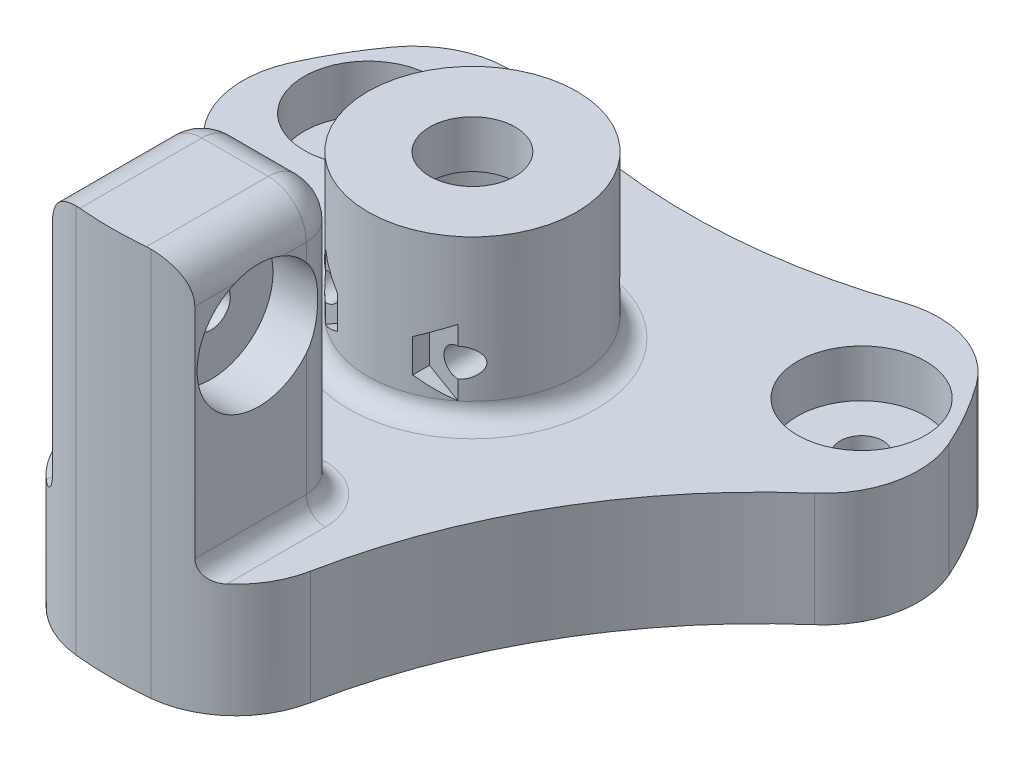
from build123d import *
from build123d.topology import SkipClean

# Parameters (mm, degrees)
SKETCH1_R                = 38
SKETCH1_R_2              = 2.25
SKETCH1_R_3              = 8
ESPESOR_BASE_MOVIL_DEPTH = 6
CUT_EXTRUDE12_START      = -6
SKETCH1_14_R             = 6.75
CUT_EXTRUDE12_DEPTH      = 5
CUT_EXTRUDE14_START      = 1
SKETCH1_16_R             = 6.75
CUT_EXTRUDE14_DEPTH      = 5
BOSS_EXTRUDE2_START      = 6
SKETCH1_8_R              = 11
SKETCH1_8_R_2            = 8
BOSS_EXTRUDE2_DEPTH      = 12
BOSS_EXTRUDE3_START      = 18
SKETCH1_9_R              = 11
BOSS_EXTRUDE3_DEPTH      = 5
CUT_EXTRUDE1_START       = 23
SKETCH1_10_R             = 4.5
CUT_EXTRUDE1_DEPTH       = 82.455110983
CUT_EXTRUDE4_START       = -8.5
SKETCH2_3_R              = 4
SKETCH2_3_R_2            = 1.5
CUT_EXTRUDE4_DEPTH       = 50.955110983
CUT_EXTRUDE5_START       = 8.5
CUT_EXTRUDE5_DEPTH       = 7
SKETCH3_R                = 2
BOSS_EXTRUDE4_DEPTH      = 7.5
CUT_EXTRUDE15_START      = -7.5
SKETCH3_4_R              = 6.5
CUT_EXTRUDE15_DEPTH      = 5
CUT_EXTRUDE16_START      = 2.5
SKETCH3_5_R              = 6.5
CUT_EXTRUDE16_DEPTH      = 5
CUT_EXTRUDE17_DEPTH      = 69.161572752
FILLET3_R                = 4
SKETCH5_R                = 11.25
CUT_EXTRUDE18_DEPTH      = 4
FILLET5_R                = 1
CUT_EXTRUDE19_DEPTH      = 10
CUT_EXTRUDE19_DEPTH_BACK = 10
SKETCH2_6_R              = 1.5
FILLET6_R                = 2
SKETCH6_R                = 49.897156105
CUT_EXTRUDE20_DEPTH      = 62.065538673
FILLET8_R                = 10


with BuildPart() as part:
    # Sketch1 → Espesor base movil (new, symmetric)
    with BuildSketch(Plane(origin=(0, 0, 0), x_dir=(1, 0, 0), z_dir=(0, 1, 0))):
        with Locations(Location((0, 0, 0), (0, 0, 270))):
            Circle(SKETCH1_R)
        with Locations(Location((-25.980762114, 15, 0), (0, 0, 270))):
            Circle(SKETCH1_R_2, mode=Mode.SUBTRACT)
        with Locations(Location((25.980762114, 15, 0), (0, 0, 270))):
            Circle(SKETCH1_R_2, mode=Mode.SUBTRACT)
        with Locations(Location((0, 0, 0), (0, 0, 270))):
            Circle(SKETCH1_R_3, mode=Mode.SUBTRACT)
    extrude(amount=ESPESOR_BASE_MOVIL_DEPTH, both=True)

    # Sketch1<14> → Cut-Extrude12 (cut)
    with BuildSketch(Plane(origin=(0, 0, 0), x_dir=(1, 0, 0), z_dir=(0, 1, 0)).offset(CUT_EXTRUDE12_START)):
        with Locations(Location((-25.980762114, 15, 0), (0, 0, 270))):
            Circle(SKETCH1_14_R)
        with Locations(Location((25.980762114, 15, 0), (0, 0, 270))):
            Circle(SKETCH1_14_R)
    extrude(amount=CUT_EXTRUDE12_DEPTH, mode=Mode.SUBTRACT)

    # Sketch1<16> → Cut-Extrude14 (cut)
    with BuildSketch(Plane(origin=(0, 0, 0), x_dir=(1, 0, 0), z_dir=(0, 1, 0)).offset(CUT_EXTRUDE14_START)):
        with Locations(Location((-25.980762114, 15, 0), (0, 0, 270))):
            Circle(SKETCH1_16_R)
        with Locations(Location((25.980762114, 15, 0), (0, 0, 270))):
            Circle(SKETCH1_16_R)
    extrude(amount=CUT_EXTRUDE14_DEPTH, mode=Mode.SUBTRACT)

    # Sketch1<8> → Boss-Extrude2 (add)
    with BuildSketch(Plane(origin=(0, 0, 0), x_dir=(1, 0, 0), z_dir=(0, 1, 0)).offset(BOSS_EXTRUDE2_START)):
        with Locations(Location((0, 0, 0), (0, 0, 270))):
            Circle(SKETCH1_8_R)
        with Locations(Location((0, 0, 0), (0, 0, 270))):
            Circle(SKETCH1_8_R_2, mode=Mode.SUBTRACT)
    extrude(amount=BOSS_EXTRUDE2_DEPTH)

    # Sketch1<9> → Boss-Extrude3 (add)
    with BuildSketch(Plane(origin=(0, 0, 0), x_dir=(1, 0, 0), z_dir=(0, 1, 0)).offset(BOSS_EXTRUDE3_START)):
        with Locations(Location((0, 0, 0), (0, 0, 270))):
            Circle(SKETCH1_9_R)
    extrude(amount=BOSS_EXTRUDE3_DEPTH)

    # Sketch1<10> → Cut-Extrude1 (cut, through all)
    with BuildSketch(Plane(origin=(0, 0, 0), x_dir=(1, 0, 0), z_dir=(0, 1, 0)).offset(CUT_EXTRUDE1_START)):
        with Locations(Location((0, 0, 0), (0, 0, 270))):
            Circle(SKETCH1_10_R)
    extrude(amount=-CUT_EXTRUDE1_DEPTH, mode=Mode.SUBTRACT)

    # Sketch2<3> → Cut-Extrude4 (cut, through all)
    # profile 1 of 2: a face of its own
    with BuildSketch(Plane.XY.offset(CUT_EXTRUDE4_START)):
        with Locations((-7, 11.5)):
            Circle(SKETCH2_3_R)
        with Locations((-7, 11.5)):
            Circle(SKETCH2_3_R_2, mode=Mode.SUBTRACT)
    # profile 2 of 2: a face of its own
    with BuildSketch(Plane.XY.offset(CUT_EXTRUDE4_START)):
        with Locations((7, 11.5)):
            Circle(SKETCH2_3_R)
        with Locations((7, 11.5)):
            Circle(SKETCH2_3_R_2, mode=Mode.SUBTRACT)
    extrude(amount=-CUT_EXTRUDE4_DEPTH, mode=Mode.SUBTRACT)

    # Sketch2 → Cut-Extrude5 (cut)
    with BuildSketch(Plane.XY.offset(CUT_EXTRUDE5_START)):
        Polygon((10.031088913, 13.25), (10.031088913, 9.75), (7, 8), (3.968911087, 9.75), (3.968911087, 13.25), (7, 15), align=None)
        Polygon((-7, 15), (-10.031088913, 13.25), (-10.031088913, 9.75), (-7, 8), (-3.968911087, 9.75), (-3.968911087, 13.25), align=None)
    extrude(amount=CUT_EXTRUDE5_DEPTH, mode=Mode.SUBTRACT)

    # Sketch3 → Boss-Extrude4 (add, symmetric)
    with BuildSketch(Plane(origin=(0, 0, 0), x_dir=(0, 0, -1), z_dir=(1, 0, 0))):
        with BuildLine():
            Line((-39, 6), (-39, 35))
            Line((-39, 35), (-25, 35))
            ThreePointArc((-25, 35), (-22.171572875, 33.828427125), (-21, 31))
            Line((-21, 31), (-21, 6))
            Line((-21, 6), (-39, 6))
        make_face()
        with Locations((-30, 25)):
            Circle(SKETCH3_R, mode=Mode.SUBTRACT)
    extrude(amount=BOSS_EXTRUDE4_DEPTH, both=True)

    # Sketch3<4> → Cut-Extrude15 (cut)
    with BuildSketch(Plane(origin=(0, 0, 0), x_dir=(0, 0, -1), z_dir=(1, 0, 0)).offset(CUT_EXTRUDE15_START)):
        with Locations((-30, 25)):
            Circle(SKETCH3_4_R)
    extrude(amount=CUT_EXTRUDE15_DEPTH, mode=Mode.SUBTRACT)

    # Sketch3<5> → Cut-Extrude16 (cut)
    with BuildSketch(Plane(origin=(0, 0, 0), x_dir=(0, 0, -1), z_dir=(1, 0, 0)).offset(CUT_EXTRUDE16_START)):
        with Locations((-30, 25)):
            Circle(SKETCH3_5_R)
    extrude(amount=CUT_EXTRUDE16_DEPTH, mode=Mode.SUBTRACT)

    # Sketch4 → Cut-Extrude17 (cut, through all)
    with SkipClean():  # the faces are left unmerged after this step: merging them gives an invalid solid
        with BuildSketch(Plane.XZ.offset(6)):
            with BuildLine():
                Line((7.5, 37.252516694), (7.5, 39))
                Line((7.5, 39), (-7.5, 39))
                Line((-7.5, 39), (-7.5, 37.252516694))
                ThreePointArc((-7.5, 37.252516694), (0, 38), (7.5, 37.252516694))
            make_face()
        extrude(amount=-CUT_EXTRUDE17_DEPTH, mode=Mode.SUBTRACT)

    # Fillet3
    # the kernel refuses this fillet: 4 mm, written as the material it takes off along each edge
    with BuildSketch(Plane(origin=(7.5, 31, 25), x_dir=(0, 1, 0), z_dir=(0, 0, 1))) as fillet3_piece_1:
        with BuildLine():
            CenterArc((4 - FILLET3_R, FILLET3_R), FILLET3_R, 270, 90)
            Line((4, FILLET3_R), (4, 0))
            Line((4, 0), (4 - FILLET3_R, 0))
        make_face()
    revolve(axis=Axis((7.5, 31, 25), (-1, 0, 0)), revolution_arc=90, mode=Mode.SUBTRACT)
    with BuildSketch(Plane(origin=(7.5, 31, 21), x_dir=(0, 0, 1), z_dir=(0, -1, 0))) as fillet3_piece_2:
        with BuildLine():
            CenterArc((FILLET3_R, FILLET3_R), FILLET3_R, 180, 90)
            Line((0, FILLET3_R), (0, 0))
            Line((0, 0), (FILLET3_R, 0))
        make_face()
    extrude(amount=25, mode=Mode.SUBTRACT)
    with BuildSketch(Plane(origin=(-7.5, 31, 25), x_dir=(0, 1, 0), z_dir=(0, 0, 1))) as fillet3_piece_3:
        with BuildLine():
            CenterArc((4 - FILLET3_R, -FILLET3_R), FILLET3_R, 0, 90)
            Line((4, -FILLET3_R), (4, 0))
            Line((4, 0), (4 - FILLET3_R, 0))
        make_face()
    revolve(axis=Axis((-7.5, 31, 25), (-1, 0, 0)), revolution_arc=90, mode=Mode.SUBTRACT)
    with BuildSketch(Plane(origin=(-7.5, 31, 21), x_dir=(0, 0, 1), z_dir=(0, -1, 0))) as fillet3_piece_4:
        with BuildLine():
            CenterArc((FILLET3_R, -FILLET3_R), FILLET3_R, 90, 90)
            Line((0, -FILLET3_R), (0, 0))
            Line((0, 0), (FILLET3_R, 0))
        make_face()
    extrude(amount=25, mode=Mode.SUBTRACT)
    with BuildSketch(Plane(origin=(-7.5, 35, 47.252516694), x_dir=(1, 0, 0), z_dir=(0, 0, -1)), Plane(origin=(7.5, 35, 47.252516694), x_dir=(0, -1, 0), z_dir=(0, 0, -1))) as fillet3_piece_5:
        with BuildLine():
            CenterArc((FILLET3_R, FILLET3_R), FILLET3_R, 180, 90)
            Line((0, FILLET3_R), (0, 0))
            Line((0, 0), (FILLET3_R, 0))
        make_face()
    extrude(amount=22.252516694, mode=Mode.SUBTRACT)

    # Sketch5 → Cut-Extrude18 (cut)
    with SkipClean():  # the faces are left unmerged after this step: merging them gives an invalid solid
        with BuildSketch(Plane.XZ.offset(6)):
            with Locations(Location((0, 0, 0), (0, 0, 270))):
                Circle(SKETCH5_R)
        extrude(amount=-CUT_EXTRUDE18_DEPTH, mode=Mode.SUBTRACT)
    add(part.part.scale(1), mode=Mode.REPLACE)  # the faces are merged on a copy

    # Fillet5
    fillet5_edges = [part.edges().sort_by_distance(p)[0] for p in [
        (0, 18, -8),
    ]]
    fillet(fillet5_edges, radius=FILLET5_R)

    # Sketch2<6> → Cut-Extrude19 (cut, two sides: drawn at the far end of the back side and taken through both)
    with BuildSketch(Plane.XY.offset(-CUT_EXTRUDE19_DEPTH_BACK)):
        with Locations(Location((7, 11.5, 0), (0, 0, 90.68298103))):
            Circle(SKETCH2_6_R)
        with Locations(Location((-7, 11.5, 0), (0, 0, 270.68298103))):
            Circle(SKETCH2_6_R)
    extrude(amount=CUT_EXTRUDE19_DEPTH + CUT_EXTRUDE19_DEPTH_BACK, mode=Mode.SUBTRACT)

    # Fillet6
    # the kernel refuses this fillet: 2 mm, written as the material it adds along each edge
    with BuildSketch(Plane(origin=(7.5, 6, 25), x_dir=(1, 0, 0), z_dir=(0, 0, 1))) as fillet6_piece_1_section:
        with BuildLine():
            CenterArc((FILLET6_R, FILLET6_R), FILLET6_R, 180, 90)
            Line((0, FILLET6_R), (0, 0))
            Line((0, 0), (FILLET6_R, 0))
        make_face()
    fillet6_piece_1 = extrude(amount=17.252516694, mode=Mode.PRIVATE)
    fillet6_piece_1 = fillet6_piece_1 & Plane(origin=(0, 6.448213696, 0), x_dir=(0, 0, 1), z_dir=(0, 1, 0)) * Cylinder(38, 43, mode=Mode.PRIVATE)
    add(fillet6_piece_1)
    with BuildSketch(Plane(origin=(3.5, 6, 25), x_dir=(0, 0, -1), z_dir=(-1, 0, 0))) as fillet6_piece_2:
        with BuildLine():
            CenterArc((4 + FILLET6_R, -FILLET6_R), FILLET6_R, 90, 90)
            Line((4, -FILLET6_R), (4, 0))
            Line((4, 0), (4 + FILLET6_R, 0))
        make_face()
    revolve(axis=Axis((3.5, 6, 25), (0, -1, 0)), revolution_arc=90)
    with BuildSketch(Plane(origin=(-3.5, 6, 21), x_dir=(0, 0, -1), z_dir=(1, 0, 0))) as fillet6_piece_3:
        with BuildLine():
            CenterArc((FILLET6_R, FILLET6_R), FILLET6_R, 180, 90)
            Line((0, FILLET6_R), (0, 0))
            Line((0, 0), (FILLET6_R, 0))
        make_face()
    extrude(amount=7)
    with BuildSketch(Plane(origin=(-3.5, 6, 25), x_dir=(-1, 0, 0), z_dir=(0, 0, 1))) as fillet6_piece_4:
        with BuildLine():
            CenterArc((4 + FILLET6_R, -FILLET6_R), FILLET6_R, 90, 90)
            Line((4, -FILLET6_R), (4, 0))
            Line((4, 0), (4 + FILLET6_R, 0))
        make_face()
    revolve(axis=Axis((-3.5, 6, 25), (0, -1, 0)), revolution_arc=90)
    with BuildSketch(Plane(origin=(-7.5, 6, 25), x_dir=(-1, 0, 0), z_dir=(0, 0, 1))) as fillet6_piece_5_section:
        with BuildLine():
            CenterArc((FILLET6_R, -FILLET6_R), FILLET6_R, 90, 90)
            Line((0, -FILLET6_R), (0, 0))
            Line((0, 0), (FILLET6_R, 0))
        make_face()
    fillet6_piece_5 = extrude(amount=17.252516694, mode=Mode.PRIVATE)
    fillet6_piece_5 = fillet6_piece_5 & Plane(origin=(0, 6.448212509, 0), x_dir=(0, 0, 1), z_dir=(0, 1, 0)) * Cylinder(38, 43, mode=Mode.PRIVATE)
    add(fillet6_piece_5)
    with BuildSketch(Plane(origin=(0, 6, 0), x_dir=(0, 0, 1), z_dir=(-1, 0, 0))) as fillet6_piece_6_section:
        with BuildLine():
            CenterArc((11 + FILLET6_R, FILLET6_R), FILLET6_R, 180, 90)
            Line((11 + FILLET6_R, 0), (11, 0))
            Line((11, 0), (11, FILLET6_R))
        make_face()
    fillet6_piece_6 = revolve(axis=Axis((0, 6, 0), (0, 1, 0)), mode=Mode.PRIVATE)
    fillet6_piece_6 = split(fillet6_piece_6, bisect_by=Plane(origin=(10.870010135, 6.560222351, -8.5), z_dir=(0, 0, 1)), keep=Keep.TOP, mode=Mode.PRIVATE)
    add(fillet6_piece_6)
    with BuildSketch(Plane(origin=(0, 6, 0), x_dir=(0, 0, 1), z_dir=(-1, 0, 0))) as fillet6_piece_7_section:
        with BuildLine():
            CenterArc((11 + FILLET6_R, FILLET6_R), FILLET6_R, 180, 90)
            Line((11 + FILLET6_R, 0), (11, 0))
            Line((11, 0), (11, FILLET6_R))
        make_face()
    fillet6_piece_7 = revolve(axis=Axis((0, 6, 0), (0, 1, 0)), mode=Mode.PRIVATE)
    fillet6_piece_7 = fillet6_piece_7 - Plane(origin=(7, 11.5, -11.568589275), x_dir=(1, 0, 0), z_dir=(0, 0, 1)) * Cylinder(4, 52, mode=Mode.PRIVATE)
    fillet6_piece_7 = fillet6_piece_7 - Plane(origin=(-7, 11.5, -11.568589275), x_dir=(1, 0, 0), z_dir=(0, 0, 1)) * Cylinder(4, 52, mode=Mode.PRIVATE)
    add(fillet6_piece_7)

    # Sketch6 → Cut-Extrude20 (cut, through all)
    with BuildSketch(Plane(origin=(0, 6, 0), x_dir=(1, 0, 0), z_dir=(0, 1, 0))):
        Circle(SKETCH6_R)
        with BuildLine():
            ThreePointArc((-21.50132037, 26.669815837), (-36.806079661, 21.25), (-33.847398214, 5.285781737))
            ThreePointArc((-33.847398214, 5.285781737), (-19.645727268, -11.342465927), (-12.346077844, -31.955597574))
            ThreePointArc((-12.346077844, -31.955597574), (0, -42.5), (12.346077844, -31.955597574))
            ThreePointArc((12.346077844, -31.955597574), (19.645727268, -11.342465927), (33.847398214, 5.285781737))
            ThreePointArc((33.847398214, 5.285781737), (36.806079661, 21.25), (21.50132037, 26.669815837))
            ThreePointArc((21.50132037, 26.669815837), (0, 22.684931853), (-21.50132037, 26.669815837))
        make_face(mode=Mode.SUBTRACT)
    extrude(amount=-CUT_EXTRUDE20_DEPTH, mode=Mode.SUBTRACT)

    # Fillet8
    # the kernel refuses this fillet: 10 mm, written as the material it takes off along each edge
    with BuildSketch(Plane(origin=(-10.699817463, -47.93720268, 36.4625), x_dir=(0.9810549155610886, 0, 0.1937298445088555), z_dir=(0, 1, 0)), Plane(origin=(-26.227542554, -47.93720268, -27.497563739), x_dir=(-0.658302424596422, 0, 0.7527535571290727), z_dir=(0, 1, 0)), Plane(origin=(36.927360017, -47.93720268, -8.964936261), x_dir=(-0.3227524909646672, 0, -0.9464834016379275), z_dir=(0, 1, 0))) as fillet8_piece_1:
        with BuildLine():
            CenterArc((5.962985477, 9.959102324), FILLET8_R, 202.286087779, 72.897555041)
            Line((-3.290032807, 6.16678738), (-4.215334635, 5.787555886))
            ThreePointArc((-4.215334635, 5.787555886), (-3.426859164, 3.757760824), (-0.739610352, -0.673035309))
            Line((-0.739610352, -0.673035309), (-0.090348265, -0.995910232))
            ThreePointArc((-0.090348265, -0.995910232), (3.433234063, -1.155411168), (6.95681639, -0.995910232))
            Line((6.95681639, -0.995910232), (6.866468125, 0))
        make_face()
    extrude(amount=95.87440536, mode=Mode.SUBTRACT)
    with BuildSketch(Plane(origin=(10.699817463, -47.93720268, 36.4625), x_dir=(0.29086519375517733, 0, -0.9567640456569023), z_dir=(0, 1, 0)), Plane(origin=(-36.927360017, -47.93720268, -8.964936261), x_dir=(0.6831493720888641, 0, 0.730278669697117), z_dir=(0, 1, 0)), Plane(origin=(26.227542554, -47.93720268, -27.497563739), x_dir=(-0.9740145658440407, 0, 0.22648537595978444), z_dir=(0, 1, 0))) as fillet8_piece_2:
        with BuildLine():
            CenterArc((5.979976634, 9.948909205), FILLET8_R, 202.896652379, 72.897555041)
            Line((-3.23210476, 6.058207931), (-4.153312899, 5.669137804))
            ThreePointArc((-4.153312899, 5.669137804), (-2.635458714, 2.485242133), (-0.836152751, -0.548496652))
            Line((-0.836152751, -0.548496652), (-0.245670653, -0.969353357))
            ThreePointArc((-0.245670653, -0.969353357), (4.928481954, -1.254669587), (7.090489495, -0.99489092))
            Line((7.090489495, -0.99489092), (6.98953378, 0))
        make_face()
    extrude(amount=95.87440536, mode=Mode.SUBTRACT)


solid = part.part
